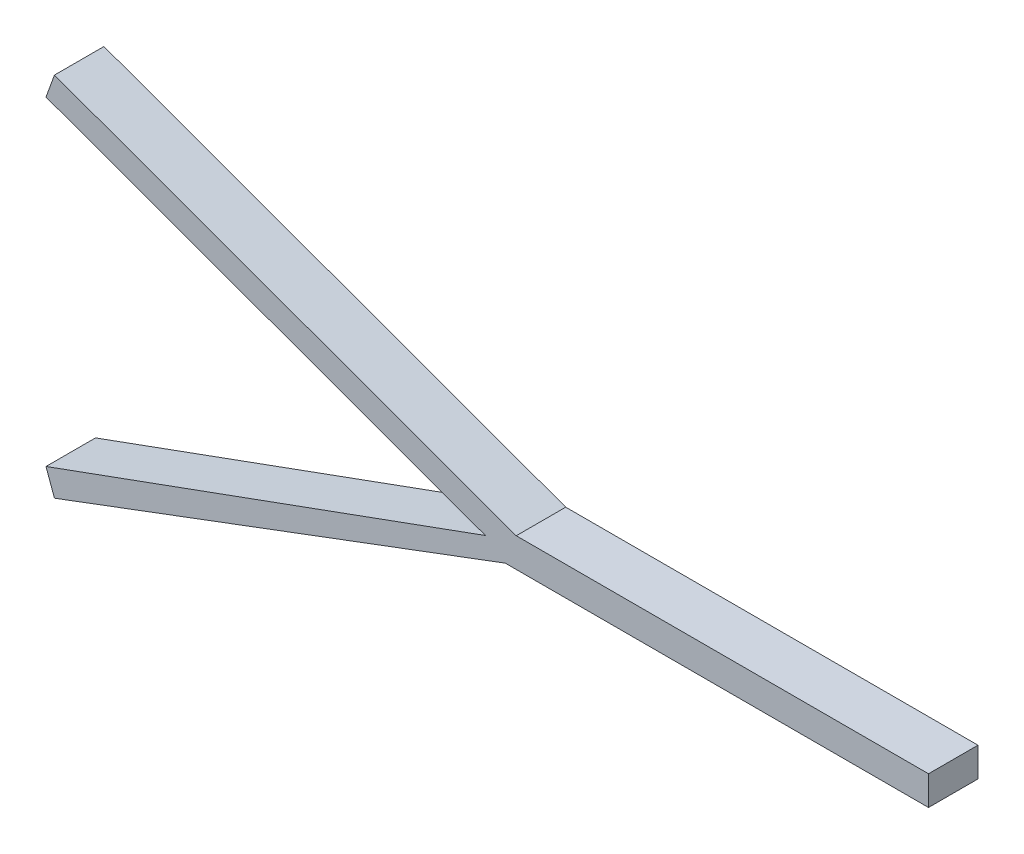
from build123d import *

# Parameters (mm, degrees)
ESTRUSIONE_ESTRUSIONE1_DEPTH = 10


with BuildPart() as part:
    # Schizzo3 → Estrusione-Estrusione1 (new body)
    with BuildSketch(Plane.XY):
        Polygon((-19.293436859, 11.064516584), (-112.593637791, 45.023012574), (-114.303738508, 40.32454947), (-25.500550709, 8.002832403), (-114.303738508, -24.318884664), (-112.593637791, -29.017347768), (-21.499586373, 5.159438405), (64.006563141, 5.159438405), (64.006563141, 11.064516584), align=None)
    extrude(amount=ESTRUSIONE_ESTRUSIONE1_DEPTH)


solid = part.part
